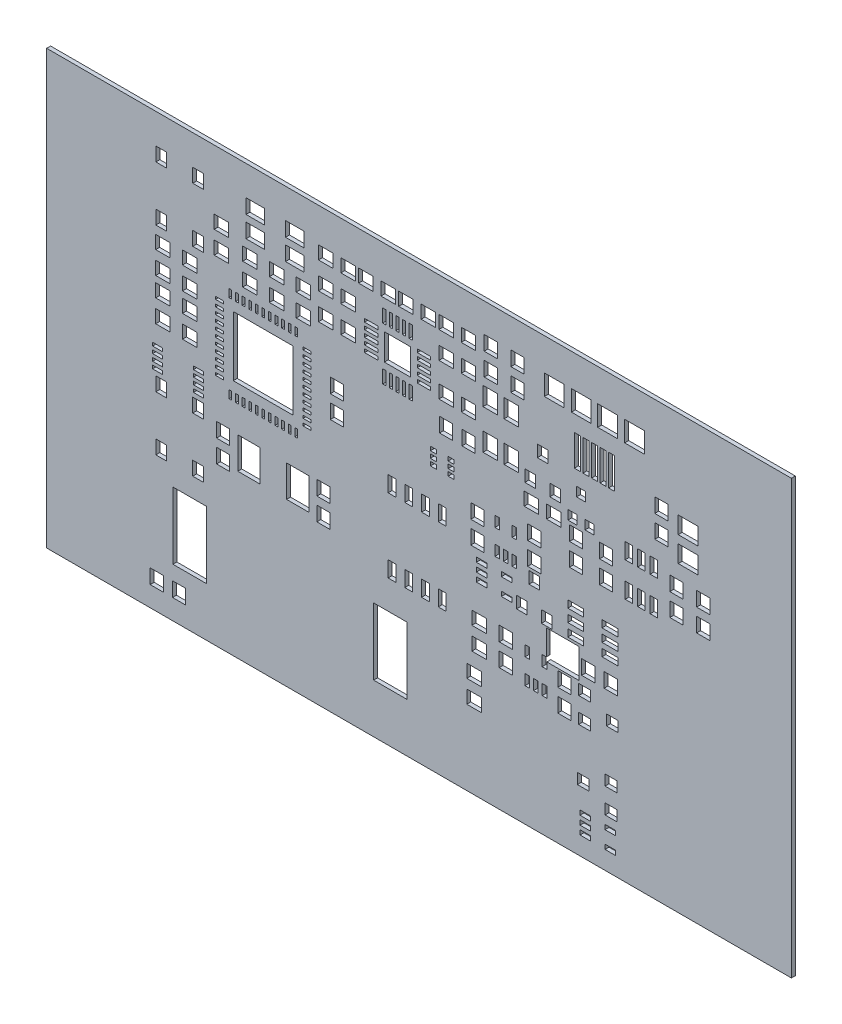
from build123d import *

# Parameters (mm, degrees)
MODEL_W             = 56.546752993
MODEL_H             = 32.861791539
MODEL_W_2           = 2.54
MODEL_H_2           = 5.080001
MODEL_W_3           = 1.000043
MODEL_H_3           = 1.100088
MODEL_H_4           = 1.09995
MODEL_W_4           = 1.499991
MODEL_H_5           = 1.299905
MODEL_H_6           = 1.300042
MODEL_W_5           = 1.099951
MODEL_H_7           = 0.999907
MODEL_W_6           = 1.100088
MODEL_H_8           = 1.099951
MODEL_W_7           = 1.000044
MODEL_W_8           = 0.999906
MODEL_H_9           = 1.000043
MODEL_W_9           = 0.999905
MODEL_W_10          = 1.09995
MODEL_W_11          = 0.20078
MODEL_H_10          = 0.600827
MODEL_W_12          = 0.200918
MODEL_W_13          = 0.200781
MODEL_W_14          = 0.600826
MODEL_H_11          = 0.20078
MODEL_H_12          = 0.200781
MODEL_H_13          = 0.200918
MODEL_H_14          = 0.600826
MODEL_W_15          = 0.600827
MODEL_W_16          = 4.550692
MODEL_H_15          = 4.550692
MODEL_W_17          = 0.450065
MODEL_H_16          = 2.349969
MODEL_W_18          = 0.450066
MODEL_W_19          = 0.449927
MODEL_H_17          = 1.550017
MODEL_W_20          = 1.499992
MODEL_W_21          = 0.899996
MODEL_H_18          = 0.800092
MODEL_H_19          = 0.80009
MODEL_H_20          = 0.799952
MODEL_W_22          = 0.899995
MODEL_H_21          = 0.799951
MODEL_H_22          = 1.000044
MODEL_H_23          = 0.999906
MODEL_W_23          = 0.599997
MODEL_H_24          = 1.199994
MODEL_H_25          = 1.199995
MODEL_W_24          = 1.699948
MODEL_H_26          = 2.399993
MODEL_W_25          = 1.399949
MODEL_H_27          = 1.399949
MODEL_H_28          = 1.400087
MODEL_W_26          = 1.099949
MODEL_W_27          = 0.799951
MODEL_H_29          = 0.350024
MODEL_H_30          = 0.350021
MODEL_H_31          = 0.35002
MODEL_W_28          = 0.812493
MODEL_H_32          = 1.049927
MODEL_W_29          = 0.35002
MODEL_H_33          = 0.800089
MODEL_W_30          = 0.350021
MODEL_W_31          = 0.549972
MODEL_W_32          = 0.550113
MODEL_W_33          = 1.199995
MODEL_H_34          = 0.549973
MODEL_H_35          = 0.550115
MODEL_H_36          = 0.549974
MODEL_H_37          = 1.050064
MODEL_H_38          = 1.050065
MODEL_W_34          = 0.249976
MODEL_W_35          = 0.249977
MODEL_H_39          = 0.249976
MODEL_H_40          = 0.249977
MODEL_W_36          = 1.999947
MODEL_H_41          = 1.999947
MODEL_W_37          = 0.699902
MODEL_H_42          = 0.700045
MODEL_W_38          = 0.700044
MODEL_W_39          = 0.699903
MODEL_H_43          = 0.899996
MODEL_W_40          = 0.79995
MODEL_W_41          = 0.349885
MODEL_W_42          = 0.800088
MODEL_H_44          = 0.350022
MODEL_W_43          = 0.449929
MODEL_H_45          = 0.299999
MODEL_W_44          = 0.450067
MODEL_W_45          = 0.750066
MODEL_W_46          = 0.749928
BOSS_EXTRUDE1_DEPTH = 0.3


with BuildPart() as part:
    # Model → Boss-Extrude1 (new body)
    with BuildSketch(Plane.XY):
        with Locations((24.019799874, 280.200151313)):
            Rectangle(MODEL_W, MODEL_H)
        with Locations((21.846099, 270.0360185)):
            Rectangle(MODEL_W_2, MODEL_H_2, mode=Mode.SUBTRACT)
        with Locations((6.606099, 270.0360185)):
            Rectangle(MODEL_W_2, MODEL_H_2, mode=Mode.SUBTRACT)
        with Locations((35.0540235, 274.568995)):
            Rectangle(MODEL_W_3, MODEL_H_3, mode=Mode.SUBTRACT)
        with Locations((35.0540235, 272.86896)):
            Rectangle(MODEL_W_3, MODEL_H_4, mode=Mode.SUBTRACT)
        with Locations((44.4518785, 287.3739835)):
            Rectangle(MODEL_W_4, MODEL_H_5, mode=Mode.SUBTRACT)
        with Locations((44.4518785, 289.273972)):
            Rectangle(MODEL_W_4, MODEL_H_6, mode=Mode.SUBTRACT)
        with Locations((24.7281115, 293.5310155)):
            Rectangle(MODEL_W_5, MODEL_H_7, mode=Mode.SUBTRACT)
        with Locations((23.028109, 293.5310155)):
            Rectangle(MODEL_W_6, MODEL_H_7, mode=Mode.SUBTRACT)
        with Locations((42.4200235, 287.981994)):
            Rectangle(MODEL_W_3, MODEL_H_3, mode=Mode.SUBTRACT)
        with Locations((42.4200235, 289.6819965)):
            Rectangle(MODEL_W_3, MODEL_H_8, mode=Mode.SUBTRACT)
        with Locations((30.6090235, 275.3309615)):
            Rectangle(MODEL_W_3, MODEL_H_8, mode=Mode.SUBTRACT)
        with Locations((30.6090235, 273.631031)):
            Rectangle(MODEL_W_3, MODEL_H_4, mode=Mode.SUBTRACT)
        with Locations((17.782058, 283.536994)):
            Rectangle(MODEL_W_7, MODEL_H_3, mode=Mode.SUBTRACT)
        with Locations((17.782058, 285.2369965)):
            Rectangle(MODEL_W_7, MODEL_H_8, mode=Mode.SUBTRACT)
        with Locations((16.766095, 276.298029)):
            Rectangle(MODEL_W_8, MODEL_H_3, mode=Mode.SUBTRACT)
        with Locations((16.766095, 277.9980315)):
            Rectangle(MODEL_W_8, MODEL_H_8, mode=Mode.SUBTRACT)
        with Locations((43.5630235, 283.4099955)):
            Rectangle(MODEL_W_3, MODEL_H_8, mode=Mode.SUBTRACT)
        with Locations((43.5630235, 285.11003)):
            Rectangle(MODEL_W_3, MODEL_H_3, mode=Mode.SUBTRACT)
        with Locations((45.5950235, 283.4099955)):
            Rectangle(MODEL_W_3, MODEL_H_8, mode=Mode.SUBTRACT)
        with Locations((45.5950235, 285.11003)):
            Rectangle(MODEL_W_3, MODEL_H_3, mode=Mode.SUBTRACT)
        with Locations((9.146095, 277.9980315)):
            Rectangle(MODEL_W_8, MODEL_H_8, mode=Mode.SUBTRACT)
        with Locations((9.146095, 276.298029)):
            Rectangle(MODEL_W_8, MODEL_H_3, mode=Mode.SUBTRACT)
        with Locations((18.6320765, 291.4990135)):
            Rectangle(MODEL_W_5, MODEL_H_9, mode=Mode.SUBTRACT)
        with Locations((16.932074, 291.4990135)):
            Rectangle(MODEL_W_6, MODEL_H_9, mode=Mode.SUBTRACT)
        with Locations((38.2290235, 282.901994)):
            Rectangle(MODEL_W_3, MODEL_H_3, mode=Mode.SUBTRACT)
        with Locations((38.2290235, 284.6019965)):
            Rectangle(MODEL_W_3, MODEL_H_8, mode=Mode.SUBTRACT)
        with Locations((29.4659545, 293.8730315)):
            Rectangle(MODEL_W_9, MODEL_H_8, mode=Mode.SUBTRACT)
        with Locations((29.4659545, 292.173029)):
            Rectangle(MODEL_W_9, MODEL_H_3, mode=Mode.SUBTRACT)
        with Locations((31.4980235, 293.8730315)):
            Rectangle(MODEL_W_3, MODEL_H_8, mode=Mode.SUBTRACT)
        with Locations((31.4980235, 292.173029)):
            Rectangle(MODEL_W_3, MODEL_H_3, mode=Mode.SUBTRACT)
        with Locations((26.076111, 293.5310155)):
            Rectangle(MODEL_W_10, MODEL_H_7, mode=Mode.SUBTRACT)
        with Locations((27.7760765, 293.5310155)):
            Rectangle(MODEL_W_5, MODEL_H_7, mode=Mode.SUBTRACT)
        with Locations((26.076111, 291.4990135)):
            Rectangle(MODEL_W_10, MODEL_H_9, mode=Mode.SUBTRACT)
        with Locations((27.7760765, 291.4990135)):
            Rectangle(MODEL_W_5, MODEL_H_9, mode=Mode.SUBTRACT)
        Polygon((33.682641, 277.503598), (33.682641, 275.576951), (33.37008, 275.576951), (33.37008, 274.777), (33.7201, 274.777), (33.7201, 275.268419), (36.171928, 275.268419), (36.171928, 277.503598), align=None, mode=Mode.SUBTRACT)
        with Locations((9.694058, 280.8080055)):
            Rectangle(MODEL_W_11, MODEL_H_10, mode=Mode.SUBTRACT)
        with Locations((10.194084, 280.8080055)):
            Rectangle(MODEL_W_12, MODEL_H_10, mode=Mode.SUBTRACT)
        with Locations((10.6941125, 280.8080055)):
            Rectangle(MODEL_W_13, MODEL_H_10, mode=Mode.SUBTRACT)
        with Locations((11.194069, 280.8080055)):
            Rectangle(MODEL_W_11, MODEL_H_10, mode=Mode.SUBTRACT)
        with Locations((11.694095, 280.8080055)):
            Rectangle(MODEL_W_12, MODEL_H_10, mode=Mode.SUBTRACT)
        with Locations((12.1940885, 280.8080055)):
            Rectangle(MODEL_W_13, MODEL_H_10, mode=Mode.SUBTRACT)
        with Locations((12.694045, 280.8080055)):
            Rectangle(MODEL_W_11, MODEL_H_10, mode=Mode.SUBTRACT)
        with Locations((13.194143, 280.8080055)):
            Rectangle(MODEL_W_11, MODEL_H_10, mode=Mode.SUBTRACT)
        with Locations((13.6940995, 280.8080055)):
            Rectangle(MODEL_W_13, MODEL_H_10, mode=Mode.SUBTRACT)
        with Locations((14.194056, 280.8080055)):
            Rectangle(MODEL_W_11, MODEL_H_10, mode=Mode.SUBTRACT)
        with Locations((14.694154, 280.8080055)):
            Rectangle(MODEL_W_11, MODEL_H_10, mode=Mode.SUBTRACT)
        with Locations((15.519123, 281.632943)):
            Rectangle(MODEL_W_14, MODEL_H_11, mode=Mode.SUBTRACT)
        with Locations((15.519123, 282.133041)):
            Rectangle(MODEL_W_14, MODEL_H_11, mode=Mode.SUBTRACT)
        with Locations((15.519123, 282.6329975)):
            Rectangle(MODEL_W_14, MODEL_H_12, mode=Mode.SUBTRACT)
        with Locations((15.519123, 283.132954)):
            Rectangle(MODEL_W_14, MODEL_H_11, mode=Mode.SUBTRACT)
        with Locations((15.519123, 283.633052)):
            Rectangle(MODEL_W_14, MODEL_H_11, mode=Mode.SUBTRACT)
        with Locations((15.519123, 284.132973)):
            Rectangle(MODEL_W_14, MODEL_H_11, mode=Mode.SUBTRACT)
        with Locations((15.519123, 284.632999)):
            Rectangle(MODEL_W_14, MODEL_H_13, mode=Mode.SUBTRACT)
        with Locations((15.519123, 285.133028)):
            Rectangle(MODEL_W_14, MODEL_H_11, mode=Mode.SUBTRACT)
        with Locations((15.519123, 285.632984)):
            Rectangle(MODEL_W_14, MODEL_H_11, mode=Mode.SUBTRACT)
        with Locations((15.519123, 286.13301)):
            Rectangle(MODEL_W_14, MODEL_H_13, mode=Mode.SUBTRACT)
        with Locations((15.519123, 286.633039)):
            Rectangle(MODEL_W_14, MODEL_H_11, mode=Mode.SUBTRACT)
        with Locations((14.694154, 287.458008)):
            Rectangle(MODEL_W_11, MODEL_H_14, mode=Mode.SUBTRACT)
        with Locations((14.194056, 287.458008)):
            Rectangle(MODEL_W_11, MODEL_H_14, mode=Mode.SUBTRACT)
        with Locations((13.6940995, 287.458008)):
            Rectangle(MODEL_W_13, MODEL_H_14, mode=Mode.SUBTRACT)
        with Locations((13.194143, 287.458008)):
            Rectangle(MODEL_W_11, MODEL_H_14, mode=Mode.SUBTRACT)
        with Locations((12.694045, 287.458008)):
            Rectangle(MODEL_W_11, MODEL_H_14, mode=Mode.SUBTRACT)
        with Locations((12.1940885, 287.458008)):
            Rectangle(MODEL_W_13, MODEL_H_14, mode=Mode.SUBTRACT)
        with Locations((11.694095, 287.458008)):
            Rectangle(MODEL_W_12, MODEL_H_14, mode=Mode.SUBTRACT)
        with Locations((11.194069, 287.458008)):
            Rectangle(MODEL_W_11, MODEL_H_14, mode=Mode.SUBTRACT)
        with Locations((10.6941125, 287.458008)):
            Rectangle(MODEL_W_13, MODEL_H_14, mode=Mode.SUBTRACT)
        with Locations((10.194084, 287.458008)):
            Rectangle(MODEL_W_12, MODEL_H_14, mode=Mode.SUBTRACT)
        with Locations((9.694058, 287.458008)):
            Rectangle(MODEL_W_11, MODEL_H_14, mode=Mode.SUBTRACT)
        with Locations((8.8691205, 286.633039)):
            Rectangle(MODEL_W_15, MODEL_H_11, mode=Mode.SUBTRACT)
        with Locations((8.8691205, 286.13301)):
            Rectangle(MODEL_W_15, MODEL_H_13, mode=Mode.SUBTRACT)
        with Locations((8.8691205, 285.632984)):
            Rectangle(MODEL_W_15, MODEL_H_11, mode=Mode.SUBTRACT)
        with Locations((8.8691205, 285.133028)):
            Rectangle(MODEL_W_15, MODEL_H_11, mode=Mode.SUBTRACT)
        with Locations((8.8691205, 284.632999)):
            Rectangle(MODEL_W_15, MODEL_H_13, mode=Mode.SUBTRACT)
        with Locations((8.8691205, 284.132973)):
            Rectangle(MODEL_W_15, MODEL_H_11, mode=Mode.SUBTRACT)
        with Locations((8.8691205, 283.633052)):
            Rectangle(MODEL_W_15, MODEL_H_11, mode=Mode.SUBTRACT)
        with Locations((8.8691205, 283.132954)):
            Rectangle(MODEL_W_15, MODEL_H_11, mode=Mode.SUBTRACT)
        with Locations((8.8691205, 282.6329975)):
            Rectangle(MODEL_W_15, MODEL_H_12, mode=Mode.SUBTRACT)
        with Locations((8.8691205, 282.133041)):
            Rectangle(MODEL_W_15, MODEL_H_11, mode=Mode.SUBTRACT)
        with Locations((8.8691205, 281.632943)):
            Rectangle(MODEL_W_15, MODEL_H_11, mode=Mode.SUBTRACT)
        with Locations((12.194099, 284.132984)):
            Rectangle(MODEL_W_16, MODEL_H_15, mode=Mode.SUBTRACT)
        with Locations((38.6401875, 290.2290065)):
            Rectangle(MODEL_W_17, MODEL_H_16, mode=Mode.SUBTRACT)
        with Locations((37.990018, 290.2290065)):
            Rectangle(MODEL_W_18, MODEL_H_16, mode=Mode.SUBTRACT)
        with Locations((37.3402015, 290.2290065)):
            Rectangle(MODEL_W_17, MODEL_H_16, mode=Mode.SUBTRACT)
        with Locations((36.6899625, 290.2290065)):
            Rectangle(MODEL_W_19, MODEL_H_16, mode=Mode.SUBTRACT)
        with Locations((36.0401465, 290.2290065)):
            Rectangle(MODEL_W_19, MODEL_H_16, mode=Mode.SUBTRACT)
        with Locations((38.3400035, 293.4039395)):
            Rectangle(MODEL_W_4, MODEL_H_17, mode=Mode.SUBTRACT)
        with Locations((36.340106, 293.4039395)):
            Rectangle(MODEL_W_20, MODEL_H_17, mode=Mode.SUBTRACT)
        with Locations((40.389995, 293.4039395)):
            Rectangle(MODEL_W_20, MODEL_H_17, mode=Mode.SUBTRACT)
        with Locations((34.2901145, 293.4039395)):
            Rectangle(MODEL_W_4, MODEL_H_17, mode=Mode.SUBTRACT)
        with Locations((38.594219, 267.815983)):
            Rectangle(MODEL_W_21, MODEL_H_18, mode=Mode.SUBTRACT)
        with Locations((38.594219, 269.716009)):
            Rectangle(MODEL_W_21, MODEL_H_19, mode=Mode.SUBTRACT)
        with Locations((36.494133, 268.766013)):
            Rectangle(MODEL_W_21, MODEL_H_19, mode=Mode.SUBTRACT)
        with Locations((36.593969, 274.669046)):
            Rectangle(MODEL_W_21, MODEL_H_20, mode=Mode.SUBTRACT)
        with Locations((36.593969, 272.768985)):
            Rectangle(MODEL_W_21, MODEL_H_20, mode=Mode.SUBTRACT)
        with Locations((38.6940555, 273.7190155)):
            Rectangle(MODEL_W_22, MODEL_H_21, mode=Mode.SUBTRACT)
        with Locations((28.5772345, 273.63096)):
            Rectangle(MODEL_W_5, MODEL_H_22, mode=Mode.SUBTRACT)
        with Locations((28.5772345, 275.331032)):
            Rectangle(MODEL_W_5, MODEL_H_22, mode=Mode.SUBTRACT)
        with Locations((16.932074, 293.5310155)):
            Rectangle(MODEL_W_6, MODEL_H_7, mode=Mode.SUBTRACT)
        with Locations((18.6320765, 293.5310155)):
            Rectangle(MODEL_W_5, MODEL_H_7, mode=Mode.SUBTRACT)
        with Locations((6.6060935, 283.15596)):
            Rectangle(MODEL_W_5, MODEL_H_22, mode=Mode.SUBTRACT)
        with Locations((6.6060935, 284.856032)):
            Rectangle(MODEL_W_5, MODEL_H_22, mode=Mode.SUBTRACT)
        with Locations((36.8711815, 276.259012)):
            Rectangle(MODEL_W_3, MODEL_H_3, mode=Mode.SUBTRACT)
        with Locations((38.571218, 276.259012)):
            Rectangle(MODEL_W_7, MODEL_H_3, mode=Mode.SUBTRACT)
        with Locations((9.019092, 289.886996)):
            Rectangle(MODEL_W_6, MODEL_H_22, mode=Mode.SUBTRACT)
        with Locations((9.019092, 291.586998)):
            Rectangle(MODEL_W_6, MODEL_H_23, mode=Mode.SUBTRACT)
        with Locations((13.210058, 288.87096)):
            Rectangle(MODEL_W_10, MODEL_H_22, mode=Mode.SUBTRACT)
        with Locations((13.210058, 290.571032)):
            Rectangle(MODEL_W_10, MODEL_H_22, mode=Mode.SUBTRACT)
        with Locations((5.8051115, 265.844978)):
            Rectangle(MODEL_W_3, MODEL_H_4, mode=Mode.SUBTRACT)
        with Locations((4.105077, 265.844978)):
            Rectangle(MODEL_W_8, MODEL_H_4, mode=Mode.SUBTRACT)
        with Locations((26.07604, 286.7999785)):
            Rectangle(MODEL_W_7, MODEL_H_8, mode=Mode.SUBTRACT)
        with Locations((27.776218, 286.7999785)):
            Rectangle(MODEL_W_7, MODEL_H_8, mode=Mode.SUBTRACT)
        with Locations((11.178092, 288.87096)):
            Rectangle(MODEL_W_6, MODEL_H_22, mode=Mode.SUBTRACT)
        with Locations((11.178092, 290.571032)):
            Rectangle(MODEL_W_6, MODEL_H_22, mode=Mode.SUBTRACT)
        with Locations((15.242129, 288.87096)):
            Rectangle(MODEL_W_10, MODEL_H_22, mode=Mode.SUBTRACT)
        with Locations((15.242129, 290.571032)):
            Rectangle(MODEL_W_10, MODEL_H_22, mode=Mode.SUBTRACT)
        with Locations((28.1962345, 269.948031)):
            Rectangle(MODEL_W_5, MODEL_H_22, mode=Mode.SUBTRACT)
        with Locations((28.1962345, 271.647961)):
            Rectangle(MODEL_W_5, MODEL_H_22, mode=Mode.SUBTRACT)
        with Locations((27.7760765, 288.9590135)):
            Rectangle(MODEL_W_5, MODEL_H_9, mode=Mode.SUBTRACT)
        with Locations((26.076111, 288.9590135)):
            Rectangle(MODEL_W_10, MODEL_H_9, mode=Mode.SUBTRACT)
        with Locations((19.9800755, 293.5310155)):
            Rectangle(MODEL_W_5, MODEL_H_7, mode=Mode.SUBTRACT)
        with Locations((21.68011, 293.5310155)):
            Rectangle(MODEL_W_6, MODEL_H_7, mode=Mode.SUBTRACT)
        with Locations((4.574092, 286.33096)):
            Rectangle(MODEL_W_6, MODEL_H_22, mode=Mode.SUBTRACT)
        with Locations((4.574092, 288.031032)):
            Rectangle(MODEL_W_6, MODEL_H_22, mode=Mode.SUBTRACT)
        with Locations((16.932074, 289.466978)):
            Rectangle(MODEL_W_6, MODEL_H_22, mode=Mode.SUBTRACT)
        with Locations((18.6320765, 289.466978)):
            Rectangle(MODEL_W_5, MODEL_H_22, mode=Mode.SUBTRACT)
        with Locations((4.574092, 283.15596)):
            Rectangle(MODEL_W_6, MODEL_H_22, mode=Mode.SUBTRACT)
        with Locations((4.574092, 284.856032)):
            Rectangle(MODEL_W_6, MODEL_H_22, mode=Mode.SUBTRACT)
        with Locations((6.6060935, 286.33096)):
            Rectangle(MODEL_W_5, MODEL_H_22, mode=Mode.SUBTRACT)
        with Locations((6.6060935, 288.031032)):
            Rectangle(MODEL_W_5, MODEL_H_22, mode=Mode.SUBTRACT)
        with Locations((21.9731305, 275.36405)):
            Rectangle(MODEL_W_23, MODEL_H_24, mode=Mode.SUBTRACT)
        with Locations((23.2431305, 275.36405)):
            Rectangle(MODEL_W_23, MODEL_H_24, mode=Mode.SUBTRACT)
        with Locations((24.5131305, 275.36405)):
            Rectangle(MODEL_W_23, MODEL_H_24, mode=Mode.SUBTRACT)
        with Locations((25.7831305, 275.36405)):
            Rectangle(MODEL_W_23, MODEL_H_24, mode=Mode.SUBTRACT)
        with Locations((25.7831305, 280.9639735)):
            Rectangle(MODEL_W_23, MODEL_H_25, mode=Mode.SUBTRACT)
        with Locations((24.5131305, 280.9639735)):
            Rectangle(MODEL_W_23, MODEL_H_25, mode=Mode.SUBTRACT)
        with Locations((23.2431305, 280.9639735)):
            Rectangle(MODEL_W_23, MODEL_H_25, mode=Mode.SUBTRACT)
        with Locations((21.9731305, 280.9639735)):
            Rectangle(MODEL_W_23, MODEL_H_25, mode=Mode.SUBTRACT)
        with Locations((14.806092, 277.2749715)):
            Rectangle(MODEL_W_24, MODEL_H_26, mode=Mode.SUBTRACT)
        with Locations((11.106088, 277.2749715)):
            Rectangle(MODEL_W_24, MODEL_H_26, mode=Mode.SUBTRACT)
        with Locations((14.5830675, 292.222984)):
            Rectangle(MODEL_W_25, MODEL_H_4, mode=Mode.SUBTRACT)
        with Locations((11.5830805, 292.222984)):
            Rectangle(MODEL_W_25, MODEL_H_4, mode=Mode.SUBTRACT)
        with Locations((11.5830805, 293.823008)):
            Rectangle(MODEL_W_25, MODEL_H_4, mode=Mode.SUBTRACT)
        with Locations((14.5830675, 293.823008)):
            Rectangle(MODEL_W_25, MODEL_H_4, mode=Mode.SUBTRACT)
        with Locations((29.428135, 287.3319655)):
            Rectangle(MODEL_W_10, MODEL_H_27, mode=Mode.SUBTRACT)
        with Locations((29.428135, 290.3320215)):
            Rectangle(MODEL_W_10, MODEL_H_28, mode=Mode.SUBTRACT)
        with Locations((31.0279825, 290.3320215)):
            Rectangle(MODEL_W_26, MODEL_H_28, mode=Mode.SUBTRACT)
        with Locations((31.0279825, 287.3319655)):
            Rectangle(MODEL_W_26, MODEL_H_27, mode=Mode.SUBTRACT)
        with Locations((38.5441965, 265.322023)):
            Rectangle(MODEL_W_27, MODEL_H_29, mode=Mode.SUBTRACT)
        with Locations((38.5441965, 266.6220445)):
            Rectangle(MODEL_W_27, MODEL_H_30, mode=Mode.SUBTRACT)
        with Locations((36.6441355, 266.6220445)):
            Rectangle(MODEL_W_27, MODEL_H_30, mode=Mode.SUBTRACT)
        with Locations((36.6441355, 265.972016)):
            Rectangle(MODEL_W_27, MODEL_H_31, mode=Mode.SUBTRACT)
        with Locations((36.6441355, 265.322023)):
            Rectangle(MODEL_W_27, MODEL_H_29, mode=Mode.SUBTRACT)
        with Locations((4.4440875, 289.6780805)):
            Rectangle(MODEL_W_28, MODEL_H_32, mode=Mode.SUBTRACT)
        with Locations((4.4440875, 293.8280525)):
            Rectangle(MODEL_W_28, MODEL_H_32, mode=Mode.SUBTRACT)
        with Locations((7.2441205, 293.8280525)):
            Rectangle(MODEL_W_28, MODEL_H_32, mode=Mode.SUBTRACT)
        with Locations((7.2441205, 289.6780805)):
            Rectangle(MODEL_W_28, MODEL_H_32, mode=Mode.SUBTRACT)
        with Locations((32.245104, 275.1769755)):
            Rectangle(MODEL_W_29, MODEL_H_21, mode=Mode.SUBTRACT)
        with Locations((32.245104, 273.2770185)):
            Rectangle(MODEL_W_29, MODEL_H_33, mode=Mode.SUBTRACT)
        with Locations((32.8949205, 273.2770185)):
            Rectangle(MODEL_W_30, MODEL_H_33, mode=Mode.SUBTRACT)
        with Locations((33.54509, 273.2770185)):
            Rectangle(MODEL_W_29, MODEL_H_33, mode=Mode.SUBTRACT)
        with Locations((41.846091, 285.5600335)):
            Rectangle(MODEL_W_31, MODEL_H_25, mode=Mode.SUBTRACT)
        with Locations((40.8961305, 285.5600335)):
            Rectangle(MODEL_W_32, MODEL_H_25, mode=Mode.SUBTRACT)
        with Locations((39.94603, 285.5600335)):
            Rectangle(MODEL_W_31, MODEL_H_25, mode=Mode.SUBTRACT)
        with Locations((39.94603, 282.960061)):
            Rectangle(MODEL_W_31, MODEL_H_24, mode=Mode.SUBTRACT)
        with Locations((40.8961305, 282.960061)):
            Rectangle(MODEL_W_32, MODEL_H_24, mode=Mode.SUBTRACT)
        with Locations((41.846091, 282.960061)):
            Rectangle(MODEL_W_31, MODEL_H_24, mode=Mode.SUBTRACT)
        with Locations((38.5131495, 277.9760555)):
            Rectangle(MODEL_W_33, MODEL_H_34, mode=Mode.SUBTRACT)
        with Locations((38.5131495, 278.9260155)):
            Rectangle(MODEL_W_33, MODEL_H_35, mode=Mode.SUBTRACT)
        with Locations((38.5131495, 279.87594)):
            Rectangle(MODEL_W_33, MODEL_H_36, mode=Mode.SUBTRACT)
        with Locations((35.9131775, 279.87594)):
            Rectangle(MODEL_W_33, MODEL_H_36, mode=Mode.SUBTRACT)
        with Locations((35.9131775, 278.9260155)):
            Rectangle(MODEL_W_33, MODEL_H_35, mode=Mode.SUBTRACT)
        with Locations((35.9131775, 277.9760555)):
            Rectangle(MODEL_W_33, MODEL_H_34, mode=Mode.SUBTRACT)
        with Locations((4.4440875, 274.565079)):
            Rectangle(MODEL_W_28, MODEL_H_37, mode=Mode.SUBTRACT)
        with Locations((4.4440875, 278.7150155)):
            Rectangle(MODEL_W_28, MODEL_H_38, mode=Mode.SUBTRACT)
        with Locations((7.2441205, 278.7150155)):
            Rectangle(MODEL_W_28, MODEL_H_38, mode=Mode.SUBTRACT)
        with Locations((7.2441205, 274.565079)):
            Rectangle(MODEL_W_28, MODEL_H_37, mode=Mode.SUBTRACT)
        with Locations((21.386111, 287.8160155)):
            Rectangle(MODEL_W_34, MODEL_H_7, mode=Mode.SUBTRACT)
        with Locations((21.8860675, 287.8160155)):
            Rectangle(MODEL_W_35, MODEL_H_7, mode=Mode.SUBTRACT)
        with Locations((22.38613, 287.8160155)):
            Rectangle(MODEL_W_34, MODEL_H_7, mode=Mode.SUBTRACT)
        with Locations((22.886087, 287.8160155)):
            Rectangle(MODEL_W_34, MODEL_H_7, mode=Mode.SUBTRACT)
        with Locations((23.386043, 287.8160155)):
            Rectangle(MODEL_W_34, MODEL_H_7, mode=Mode.SUBTRACT)
        with Locations((24.386095, 288.816037)):
            Rectangle(MODEL_W_8, MODEL_H_39, mode=Mode.SUBTRACT)
        with Locations((24.386095, 289.315994)):
            Rectangle(MODEL_W_8, MODEL_H_39, mode=Mode.SUBTRACT)
        with Locations((24.386095, 289.8159505)):
            Rectangle(MODEL_W_8, MODEL_H_40, mode=Mode.SUBTRACT)
        with Locations((24.386095, 290.316048)):
            Rectangle(MODEL_W_8, MODEL_H_39, mode=Mode.SUBTRACT)
        with Locations((24.386095, 290.816005)):
            Rectangle(MODEL_W_8, MODEL_H_39, mode=Mode.SUBTRACT)
        with Locations((23.386043, 291.8159845)):
            Rectangle(MODEL_W_34, MODEL_H_9, mode=Mode.SUBTRACT)
        with Locations((22.886087, 291.8159845)):
            Rectangle(MODEL_W_34, MODEL_H_9, mode=Mode.SUBTRACT)
        with Locations((22.38613, 291.8159845)):
            Rectangle(MODEL_W_34, MODEL_H_9, mode=Mode.SUBTRACT)
        with Locations((21.8860675, 291.8159845)):
            Rectangle(MODEL_W_35, MODEL_H_9, mode=Mode.SUBTRACT)
        with Locations((21.386111, 291.8159845)):
            Rectangle(MODEL_W_34, MODEL_H_9, mode=Mode.SUBTRACT)
        with Locations((20.386123, 290.816005)):
            Rectangle(MODEL_W_7, MODEL_H_39, mode=Mode.SUBTRACT)
        with Locations((20.386123, 290.316048)):
            Rectangle(MODEL_W_7, MODEL_H_39, mode=Mode.SUBTRACT)
        with Locations((20.386123, 289.8159505)):
            Rectangle(MODEL_W_7, MODEL_H_40, mode=Mode.SUBTRACT)
        with Locations((20.386123, 289.315994)):
            Rectangle(MODEL_W_7, MODEL_H_39, mode=Mode.SUBTRACT)
        with Locations((20.386123, 288.816037)):
            Rectangle(MODEL_W_7, MODEL_H_39, mode=Mode.SUBTRACT)
        with Locations((22.3860855, 289.8160115)):
            Rectangle(MODEL_W_36, MODEL_H_41, mode=Mode.SUBTRACT)
        with Locations((35.674067, 285.7479965)):
            Rectangle(MODEL_W_37, MODEL_H_42, mode=Mode.SUBTRACT)
        with Locations((36.974124, 285.7479965)):
            Rectangle(MODEL_W_38, MODEL_H_42, mode=Mode.SUBTRACT)
        with Locations((36.3242365, 287.5979985)):
            Rectangle(MODEL_W_39, MODEL_H_42, mode=Mode.SUBTRACT)
        with Locations((32.4531355, 286.688959)):
            Rectangle(MODEL_W_27, MODEL_H_43, mode=Mode.SUBTRACT)
        with Locations((34.3531965, 286.688959)):
            Rectangle(MODEL_W_27, MODEL_H_43, mode=Mode.SUBTRACT)
        with Locations((33.403166, 288.788975)):
            Rectangle(MODEL_W_40, MODEL_H_43, mode=Mode.SUBTRACT)
        with Locations((34.253077, 285.1490135)):
            Rectangle(MODEL_W_10, MODEL_H_9, mode=Mode.SUBTRACT)
        with Locations((32.55311, 285.1490135)):
            Rectangle(MODEL_W_6, MODEL_H_9, mode=Mode.SUBTRACT)
        with Locations((35.9430235, 282.901994)):
            Rectangle(MODEL_W_3, MODEL_H_3, mode=Mode.SUBTRACT)
        with Locations((35.9430235, 284.6019965)):
            Rectangle(MODEL_W_3, MODEL_H_8, mode=Mode.SUBTRACT)
        with Locations((31.25909, 282.543011)):
            Rectangle(MODEL_W_29, MODEL_H_20, mode=Mode.SUBTRACT)
        with Locations((29.9590365, 282.543011)):
            Rectangle(MODEL_W_41, MODEL_H_20, mode=Mode.SUBTRACT)
        with Locations((29.9590365, 280.642985)):
            Rectangle(MODEL_W_41, MODEL_H_20, mode=Mode.SUBTRACT)
        with Locations((30.6092055, 280.642985)):
            Rectangle(MODEL_W_41, MODEL_H_20, mode=Mode.SUBTRACT)
        with Locations((31.25909, 280.642985)):
            Rectangle(MODEL_W_29, MODEL_H_20, mode=Mode.SUBTRACT)
        with Locations((32.7680235, 283.0780315)):
            Rectangle(MODEL_W_3, MODEL_H_8, mode=Mode.SUBTRACT)
        with Locations((32.7680235, 281.378029)):
            Rectangle(MODEL_W_3, MODEL_H_3, mode=Mode.SUBTRACT)
        with Locations((28.450023, 282.3159615)):
            Rectangle(MODEL_W_7, MODEL_H_8, mode=Mode.SUBTRACT)
        with Locations((28.450023, 280.616031)):
            Rectangle(MODEL_W_7, MODEL_H_4, mode=Mode.SUBTRACT)
        with Locations((31.8181355, 278.052959)):
            Rectangle(MODEL_W_27, MODEL_H_43, mode=Mode.SUBTRACT)
        with Locations((33.7181965, 278.052959)):
            Rectangle(MODEL_W_27, MODEL_H_43, mode=Mode.SUBTRACT)
        with Locations((32.768166, 280.152939)):
            Rectangle(MODEL_W_40, MODEL_H_43, mode=Mode.SUBTRACT)
        with Locations((30.669913, 278.022024)):
            Rectangle(MODEL_W_42, MODEL_H_44, mode=Mode.SUBTRACT)
        with Locations((30.669913, 279.322045)):
            Rectangle(MODEL_W_42, MODEL_H_44, mode=Mode.SUBTRACT)
        with Locations((28.7701355, 279.322045)):
            Rectangle(MODEL_W_27, MODEL_H_44, mode=Mode.SUBTRACT)
        with Locations((28.7701355, 278.672017)):
            Rectangle(MODEL_W_27, MODEL_H_44, mode=Mode.SUBTRACT)
        with Locations((28.7701355, 278.022024)):
            Rectangle(MODEL_W_27, MODEL_H_44, mode=Mode.SUBTRACT)
        with Locations((25.1081275, 283.8870255)):
            Rectangle(MODEL_W_43, MODEL_H_45, mode=Mode.SUBTRACT)
        with Locations((25.1081275, 284.3869465)):
            Rectangle(MODEL_W_43, MODEL_H_45, mode=Mode.SUBTRACT)
        with Locations((25.1081275, 284.8870445)):
            Rectangle(MODEL_W_43, MODEL_H_45, mode=Mode.SUBTRACT)
        with Locations((26.4581005, 284.8870445)):
            Rectangle(MODEL_W_44, MODEL_H_45, mode=Mode.SUBTRACT)
        with Locations((26.4581005, 284.3869465)):
            Rectangle(MODEL_W_44, MODEL_H_45, mode=Mode.SUBTRACT)
        with Locations((26.4581005, 283.8870255)):
            Rectangle(MODEL_W_44, MODEL_H_45, mode=Mode.SUBTRACT)
        with Locations((7.267058, 279.700048)):
            Rectangle(MODEL_W_45, MODEL_H_39, mode=Mode.SUBTRACT)
        with Locations((7.267058, 280.2000045)):
            Rectangle(MODEL_W_45, MODEL_H_40, mode=Mode.SUBTRACT)
        with Locations((7.267058, 280.699961)):
            Rectangle(MODEL_W_45, MODEL_H_39, mode=Mode.SUBTRACT)
        with Locations((7.267058, 281.200059)):
            Rectangle(MODEL_W_45, MODEL_H_39, mode=Mode.SUBTRACT)
        with Locations((4.167096, 281.200059)):
            Rectangle(MODEL_W_46, MODEL_H_39, mode=Mode.SUBTRACT)
        with Locations((4.167096, 280.699961)):
            Rectangle(MODEL_W_46, MODEL_H_39, mode=Mode.SUBTRACT)
        with Locations((4.167096, 280.2000045)):
            Rectangle(MODEL_W_46, MODEL_H_40, mode=Mode.SUBTRACT)
        with Locations((4.167096, 279.700048)):
            Rectangle(MODEL_W_46, MODEL_H_39, mode=Mode.SUBTRACT)
    extrude(amount=BOSS_EXTRUDE1_DEPTH)


solid = part.part
